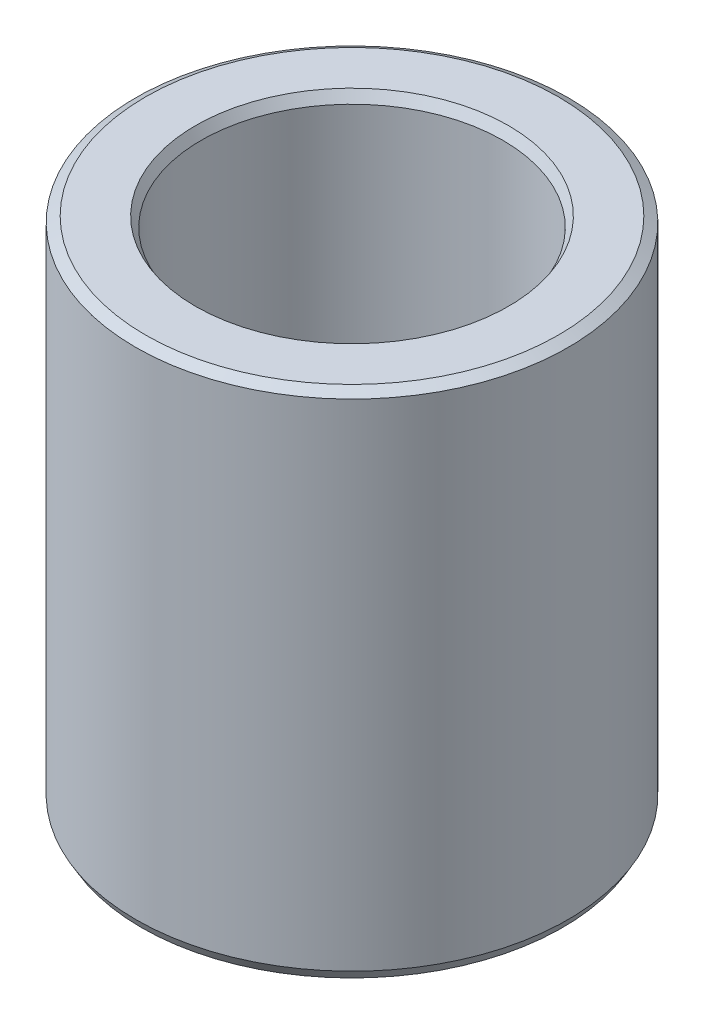
from build123d import *
from OCP.BRepFilletAPI import BRepFilletAPI_MakeChamfer

# Parameters (mm, degrees)
SKETCH1_R           = 30
BOSS_EXTRUDE1_DEPTH = 70.898357044
SKETCH2_R           = 20.925477656
CUT_EXTRUDE1_DEPTH  = 83.623102287
CHAMFER1_SIZE       = 0.791273635
CHAMFER1_SIZE2      = 1.370526139


with BuildPart() as part:
    # Sketch1 → Boss-Extrude1 (new body)
    with BuildSketch(Plane(origin=(0, 0, 0), x_dir=(1, 0, 0), z_dir=(0, 1, 0))):
        Circle(SKETCH1_R)
    extrude(amount=BOSS_EXTRUDE1_DEPTH)

    # Sketch2 → Cut-Extrude1 (cut, through all)
    with BuildSketch(Plane(origin=(0, 0, 0), x_dir=(1, 0, 0), z_dir=(0, 1, 0))):
        Circle(SKETCH2_R)
    extrude(amount=CUT_EXTRUDE1_DEPTH, mode=Mode.SUBTRACT)

    # Chamfer1: one chamfer whose edges measure the first distance from different faces: ONE call of the kernel's chamfer builder (chamfer() names one face for all edges)
    chamfer1_edges_1 = [part.edges().sort_by_distance(p)[0] for p in [
        (-20.925477656, 70.898357044, 0),
    ]]
    chamfer1_side_1 = [part.faces().sort_by_distance(p)[0] for p in [
        (-29.151471863, 70.898357044, 0),
    ]]
    chamfer1_edges_2 = [part.edges().sort_by_distance(p)[0] for p in [
        (-20.925477656, 0, 0),
    ]]
    chamfer1_side_2 = [part.faces().sort_by_distance(p)[0] for p in [
        (-20.925477656, 35.449178522, 0),
    ]]
    chamfer1_edges_3 = [part.edges().sort_by_distance(p)[0] for p in [
        (-30, 0, 0),
    ]]
    chamfer1_side_3 = [part.faces().sort_by_distance(p)[0] for p in [
        (-29.151471863, 0, 0),
    ]]
    chamfer1_edges_4 = [part.edges().sort_by_distance(p)[0] for p in [
        (-30, 70.898357044, 0),
    ]]
    chamfer1_side_4 = [part.faces().sort_by_distance(p)[0] for p in [
        (-30, 35.449178522, 0),
    ]]
    chamfer1 = BRepFilletAPI_MakeChamfer(part.part.solid().wrapped)
    for e in chamfer1_edges_1:
        chamfer1.Add(CHAMFER1_SIZE, CHAMFER1_SIZE2, e.wrapped, chamfer1_side_1[0].wrapped)  # the first distance lies on this face
    for e in chamfer1_edges_2:
        chamfer1.Add(CHAMFER1_SIZE, CHAMFER1_SIZE2, e.wrapped, chamfer1_side_2[0].wrapped)  # the first distance lies on this face
    for e in chamfer1_edges_3:
        chamfer1.Add(CHAMFER1_SIZE, CHAMFER1_SIZE2, e.wrapped, chamfer1_side_3[0].wrapped)  # the first distance lies on this face
    for e in chamfer1_edges_4:
        chamfer1.Add(CHAMFER1_SIZE, CHAMFER1_SIZE2, e.wrapped, chamfer1_side_4[0].wrapped)  # the first distance lies on this face
    add(Compound.cast(chamfer1.Shape()), mode=Mode.REPLACE)


solid = part.part
